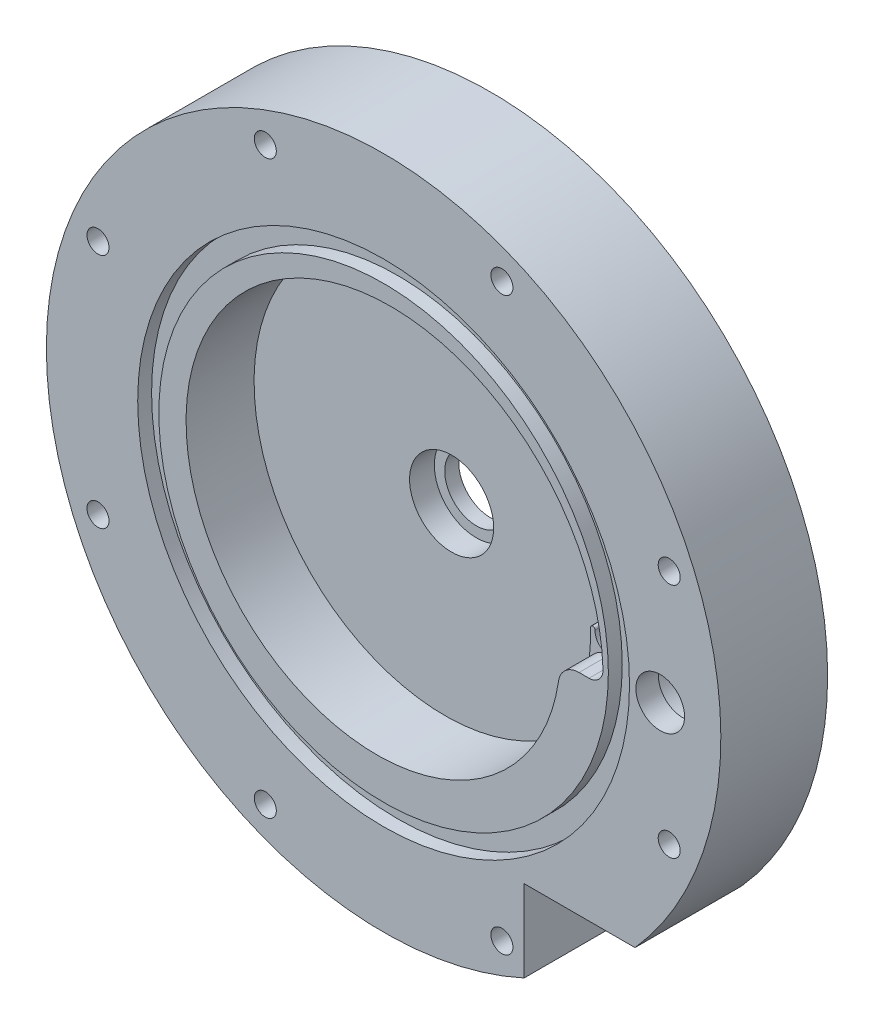
from build123d import *

# Parameters (mm, degrees)
VOLUTE_CUT_DEPTH         = 109.853225441
CAP_CUT_DEPTH            = 110.150134912
SKETCH28_W               = 25.046126628
SKETCH28_H               = 18.470321928
OUTLET_HOLE_CUT_DEPTH    = 111.431593896
OUTLET_PIPE_THREAD_D     = 14.2748
OUTLET_PIPE_THREAD_DEPTH = 12.7
OUTLET_PIPE_THREAD_TIP   = 4.288582582
SKETCH26_R               = 2.4892
FASTENER_HOLE_DEPTH      = 111.431593896
FASTENER_HOLES_COUNT     = 8
SKETCH16_R               = 55.5625
SKETCH16_R_2             = 50.7873
O_RING_GROOVE_DEPTH      = 3.1369


with BuildPart() as part:
    # Sketch22 → Main Body (revolve)
    with BuildSketch(Plane(origin=(0, 0, 0), x_dir=(1, 0, 0), z_dir=(0, 1, 0))):
        Polygon((-25.4, 0), (-9.5, 0), (-9.5, 5.588), (-7.14375, 5.588), (-7.14375, 8.763), (-76.2, 8.763), (-76.2, -15.367), (-25.4, -15.367), align=None)
    revolve(axis=Axis((0, 0, 0), (0, 0, -1)))

    # Sketch23 → Volute Cut (cut, through all)
    with BuildSketch(Plane.XY):
        with BuildLine():
            Line((44.166924028, -3.278948669), (46.409987281, -3.278948669))
            ThreePointArc((46.409987281, -3.278948669), (48.689668065, -2.311613487), (49.577995098, 0))
            add(Edge.make_bspline(
                [(39.939526111, 0), (39.942269446, -0.0837473), (39.947756723, -0.251260409), (39.954015699, -0.502616311), (39.958818633, -0.754058522), (39.965227666, -1.257271925), (39.961619732, -2.517021244), (39.875091851, -4.365243066), (39.649454652, -6.542756078), (39.33988264, -8.543760179), (38.929454388, -10.530211789), (38.418824768, -12.497026639), (37.808911738, -14.439148731), (37.100892119, -16.351564673), (36.296198826, -18.22931668), (35.396517359, -20.067515799), (34.403782101, -21.86135476), (33.320172005, -23.606120692), (32.148105775, -25.297207577), (30.890236459, -26.930128476), (29.549445458, -28.500527466), (28.128835965, -30.00419128), (26.631725823, -31.437060619), (25.061639825, -32.795241099), (23.422301466, -34.075013818), (21.717624168, -35.272845505), (19.951701985, -36.385398236), (18.128799822, -37.409538673), (16.253343185, -38.342346824), (14.329907485, -39.18112428), (12.363206918, -39.923401923), (10.358082955, -40.566947066), (8.319492465, -41.109770024), (6.2524955, -41.550130082), (4.162242776, -41.886540847), (2.053962868, -42.117774975), (-0.06705083, -42.242868254), (-2.195453363, -42.261123016), (-4.325861655, -42.172110902), (-6.452868085, -41.975674931), (-8.57105419, -41.671930888), (-10.675004435, -41.261268029), (-12.759320026, -40.744349078), (-14.818632734, -40.12210953), (-16.847618693, -39.395756259), (-18.841012126, -38.56676542), (-20.793618979, -37.636879662), (-22.700330424, -36.608104648), (-24.556136184, -35.482704889), (-26.356137661, -34.263198905), (-28.095560825, -32.952353715), (-29.769768833, -31.55317868), (-31.374274336, -30.068918699), (-32.904751456, -28.503046779), (-34.357047394, -26.859256), (-35.727193628, -25.141450883), (-37.011416693, -23.353738194), (-38.206148494, -21.500417195), (-39.308036131, -19.585969367), (-40.313951213, -17.615047632), (-41.220998633, -15.592465105), (-42.026524769, -13.523183384), (-42.728125112, -11.412300433), (-43.323651272, -9.265038062), (-43.811217363, -7.086729057), (-44.189205737, -4.882803972), (-44.45627205, -2.658777629), (-44.611349658, -0.420235354), (-44.653653307, 1.827181013), (-44.582682128, 4.077787306), (-44.398221909, 6.325871377), (-44.100346646, 8.56570756), (-43.689419363, 10.791571224), (-43.166092199, 12.997753372), (-42.531305754, 15.17857525), (-41.786287694, 17.328402935), (-40.932550626, 19.441661853), (-39.971889229, 21.5128512), (-38.906376662, 23.536558227), (-37.738360243, 25.507472342), (-36.470456415, 27.420399009), (-35.105545007, 29.270273394), (-33.646762806, 31.052173728), (-32.097496441, 32.761334351), (-30.461374618, 34.393158406), (-28.742259697, 35.943230135), (-26.94423865, 37.407326771), (-25.071613414, 38.781429964), (-23.128890663, 40.061736735), (-21.120771014, 41.244669906), (-19.052137713, 42.326888003), (-16.928044805, 43.305294581), (-14.753704833, 44.177046957), (-12.534476089, 44.939564331), (-10.275849449, 45.590535256), (-7.983434825, 46.127924454), (-5.662947262, 46.549978947), (-3.32019273, 46.855233489), (-0.961053623, 47.042515279), (1.408525976, 47.110947946), (3.782555248, 47.059954789), (6.155011749, 46.889261268), (8.519856664, 46.598896718), (10.871050148, 46.189195315), (13.202566726, 45.660796242), (15.5084107, 45.014643097), (17.782631543, 44.251982509), (20.019339221, 43.374361984), (22.21271942, 42.383626969), (24.357048618, 41.281917146), (26.446708992, 40.07166197), (28.476203094, 38.755575441), (30.440168269, 37.336650139), (32.333390787, 35.818150527), (34.150819627, 34.203605534), (35.887579905, 32.496800442), (37.53898589, 30.70176809), (39.100553583, 28.822779415), (40.568012821, 26.864333353), (41.937318874, 24.831146131), (43.204663511, 22.728139958), (44.366485495, 20.560431162), (45.419480476, 18.333317788), (46.360610274, 16.052266689), (47.187111503, 13.722900146), (47.896503526, 11.35098205), (48.486595709, 8.942403666), (48.955493971, 6.503169041), (49.272698681, 4.245159804), (49.431000562, 2.592939581), (49.496684411, 1.660906774), (49.521980456, 1.24612125), (49.539009606, 0.934823446), (49.554044624, 0.6233596), (49.56726265, 0.311747828), (49.574417371, 0.103923043), (49.577995098, 0)],
                knots=[0, 0, 0, 0, 0.000895368, 0.001790933, 0.002686696, 0.003582656, 0.00716847, 0.016146863, 0.023343889, 0.030553689, 0.037776306, 0.045011781, 0.052260149, 0.059521445, 0.0667957, 0.074082946, 0.08138321, 0.088696521, 0.096022905, 0.103362389, 0.110714996, 0.11808075, 0.125459676, 0.132851796, 0.140257131, 0.147675704, 0.155107535, 0.162552646, 0.170011055, 0.177482784, 0.184967851, 0.192466275, 0.199978075, 0.207503269, 0.215041875, 0.222593912, 0.230159396, 0.237738345, 0.245330775, 0.252936704, 0.260556148, 0.268189123, 0.275835645, 0.28349573, 0.291169394, 0.298856653, 0.306557521, 0.314272014, 0.322000147, 0.329741934, 0.337497391, 0.345266532, 0.35304937, 0.360845922, 0.368656199, 0.376480218, 0.384317991, 0.392169531, 0.400034854, 0.407913972, 0.415806898, 0.423713647, 0.43163423, 0.439568662, 0.447516954, 0.455479121, 0.463455174, 0.471445127, 0.479448991, 0.48746678, 0.495498506, 0.503544181, 0.511603818, 0.519677428, 0.527765023, 0.535866616, 0.543982219, 0.552111843, 0.5602555, 0.568413202, 0.57658496, 0.584770787, 0.592970693, 0.60118469, 0.609412789, 0.617655002, 0.625911339, 0.634181813, 0.642466433, 0.650765212, 0.65907816, 0.667405288, 0.675746607, 0.684102128, 0.692471861, 0.700855818, 0.709254008, 0.717666443, 0.726093134, 0.734534089, 0.742989321, 0.75145884, 0.759942655, 0.768440778, 0.776953218, 0.785479986, 0.794021092, 0.802576546, 0.811146358, 0.819730538, 0.828329097, 0.836942043, 0.845569388, 0.854211141, 0.862867312, 0.87153791, 0.880222946, 0.888922429, 0.89763637, 0.906364776, 0.915107659, 0.923865028, 0.932636892, 0.94142326, 0.950224144, 0.959039551, 0.967869491, 0.976713973, 0.985573008, 0.992226839, 0.994446604, 0.995556828, 0.996667279, 0.997777958, 0.998888865, 1, 1, 1, 1], degree=3))
            ThreePointArc((39.939526111, 0), (40.466576111, 0.544597432), (40.993626111, 0))
            ThreePointArc((40.993626111, 0), (41.885404576, -2.31195546), (44.166924028, -3.278948669))
        make_face()
    extrude(amount=VOLUTE_CUT_DEPTH, mode=Mode.SUBTRACT)

    # Sketch25 → Cap Cut (cut, through all)
    with BuildSketch(Plane.XY.offset(8.58266)):
        with BuildLine():
            ThreePointArc((39.530232145, -7.279976568), (41.104770543, -4.417482526), (44.166924028, -3.278948669))
            ThreePointArc((44.166924028, -3.278948669), (41.885404576, -2.31195546), (40.993626111, 0))
            ThreePointArc((40.993626111, 0), (40.466576111, 0.544597432), (39.939526111, 0))
            add(Edge.make_bspline(
                [(39.530232145, -7.279976568), (39.566715351, -7.033442985), (39.69332497, -6.119385335), (39.875091851, -4.365243066), (39.961619732, -2.517021244), (39.965227666, -1.257271925), (39.958818633, -0.754058522), (39.954015699, -0.502616311), (39.947756723, -0.251260409), (39.942269446, -0.0837473), (39.939526111, 0)],
                knots=[0.973993066, 0.973993066, 0.973993066, 0.973993066, 0.976656111, 0.983853137, 0.99283153, 0.996417344, 0.997313304, 0.998209067, 0.999104632, 1, 1, 1, 1], degree=3))
        make_face()
    extrude(amount=CAP_CUT_DEPTH, mode=Mode.SUBTRACT)

    # Sketch28 → Outlet Hole Cut (cut, through all)
    with BuildSketch(Plane.XY.offset(15.367)):
        with Locations((44.273063314, -60.035160964)):
            Rectangle(SKETCH28_W, SKETCH28_H)
    extrude(amount=-OUTLET_HOLE_CUT_DEPTH, mode=Mode.SUBTRACT)

    # Sketch20 → Outlet Hole (revolve, cut)
    with BuildSketch(Plane(origin=(45.288455655, -50.8, 4.29133), x_dir=(0, 0, -1), z_dir=(1, 0, 0))):
        Polygon((0, 0), (0, 53.661598698), (4.7625, 50.8), (4.7625, 0), align=None)
    revolve(axis=Axis((45.288455655, -57.15, 4.29133), (0, 1, 0)), mode=Mode.SUBTRACT)

    # Outlet Pipe Thread
    with Locations(Plane(origin=(45.288455655, -50.8, 4.29133), x_dir=(0, 0, -1), z_dir=(0, -1, 0))):
        with Locations((0, 0)):
            Hole(OUTLET_PIPE_THREAD_D / 2, depth=OUTLET_PIPE_THREAD_DEPTH)
            with Locations((0, 0, -(OUTLET_PIPE_THREAD_DEPTH + OUTLET_PIPE_THREAD_TIP / 2))):  # 118° drill point
                Cone(0, OUTLET_PIPE_THREAD_D / 2, OUTLET_PIPE_THREAD_TIP, mode=Mode.SUBTRACT)

    # Sketch26 → Fastener Hole (cut, through all)
    with BuildSketch(Plane.XY.offset(15.367)):
        with Locations((64.532985346, -26.730437751)):
            Circle(SKETCH26_R)
    fastener_hole = extrude(amount=-FASTENER_HOLE_DEPTH, mode=Mode.SUBTRACT)

    # Fastener Holes: Fastener Hole ×8 about axis
    fastener_holes_axis = Axis((0, 0, 0), (0, 0, 1))
    for i in range(1, FASTENER_HOLES_COUNT):
        add(fastener_hole.rotate(fastener_holes_axis, i * 360 / FASTENER_HOLES_COUNT), mode=Mode.SUBTRACT)

    # Sketch16 → O-Ring Groove (cut)
    with BuildSketch(Plane.XY.offset(15.367)):
        Circle(SKETCH16_R)
        Circle(SKETCH16_R_2, mode=Mode.SUBTRACT)
    extrude(amount=-O_RING_GROOVE_DEPTH, mode=Mode.SUBTRACT)

    # Sketch27 → Turbine Shaft Hole (revolve, cut)
    with BuildSketch(Plane.ZX):
        Polygon((15.367, 62.5), (-8.763, 62.5), (-8.763, 51.324), (3.937, 51.324), (3.937, 54.5625), (10.287, 54.5625), (10.287, 57), (15.367, 57), align=None)
    revolve(axis=Axis((62.5, 0, 15.367), (0, 0, -1)), mode=Mode.SUBTRACT)


solid = part.part
